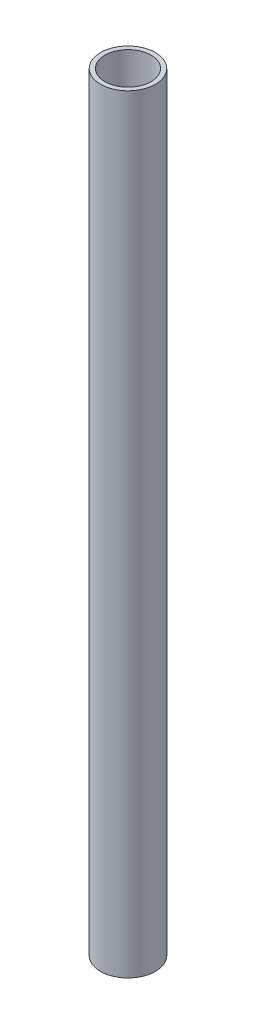
from build123d import *

# Parameters (mm, degrees)
SKETCH1_R           = 12.5
SKETCH1_R_2         = 10.5
BOSS_EXTRUDE1_DEPTH = 350


with BuildPart() as part:
    # Sketch1 → Boss-Extrude1 (new body)
    with BuildSketch(Plane(origin=(0, 0, 0), x_dir=(1, 0, 0), z_dir=(0, 1, 0))):
        Circle(SKETCH1_R)
        Circle(SKETCH1_R_2, mode=Mode.SUBTRACT)
    extrude(amount=BOSS_EXTRUDE1_DEPTH)


solid = part.part
